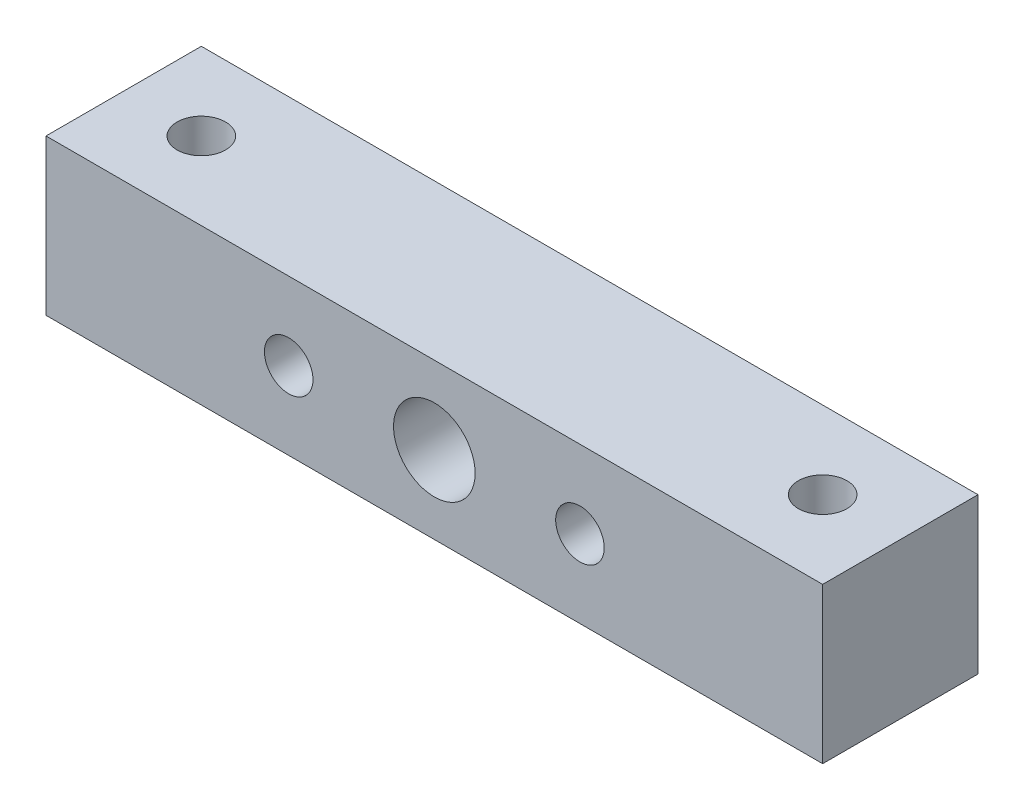
from build123d import *

# Parameters (mm, degrees)
SKETCH1_W           = 40
SKETCH1_H           = 8
SKETCH1_R           = 2.1
SKETCH1_R_2         = 1.25
BOSS_EXTRUDE1_DEPTH = 8
SKETCH2_R           = 1.25
CUT_EXTRUDE1_DEPTH  = 23.978250586


with BuildPart() as part:
    # Sketch1 → Boss-Extrude1 (new body)
    with BuildSketch(Plane.XY):
        Rectangle(SKETCH1_W, SKETCH1_H)
        Circle(SKETCH1_R, mode=Mode.SUBTRACT)
        with Locations((7.5, 0)):
            Circle(SKETCH1_R_2, mode=Mode.SUBTRACT)
        with Locations((-7.5, 0)):
            Circle(SKETCH1_R_2, mode=Mode.SUBTRACT)
    extrude(amount=BOSS_EXTRUDE1_DEPTH)

    # Sketch2 → Cut-Extrude1 (cut, through all)
    with BuildSketch(Plane.XZ.offset(4)):
        with Locations((-16, 4)):
            Circle(SKETCH2_R)
        with Locations((16, 4)):
            Circle(SKETCH2_R)
    extrude(amount=-CUT_EXTRUDE1_DEPTH, mode=Mode.SUBTRACT)


solid = part.part
